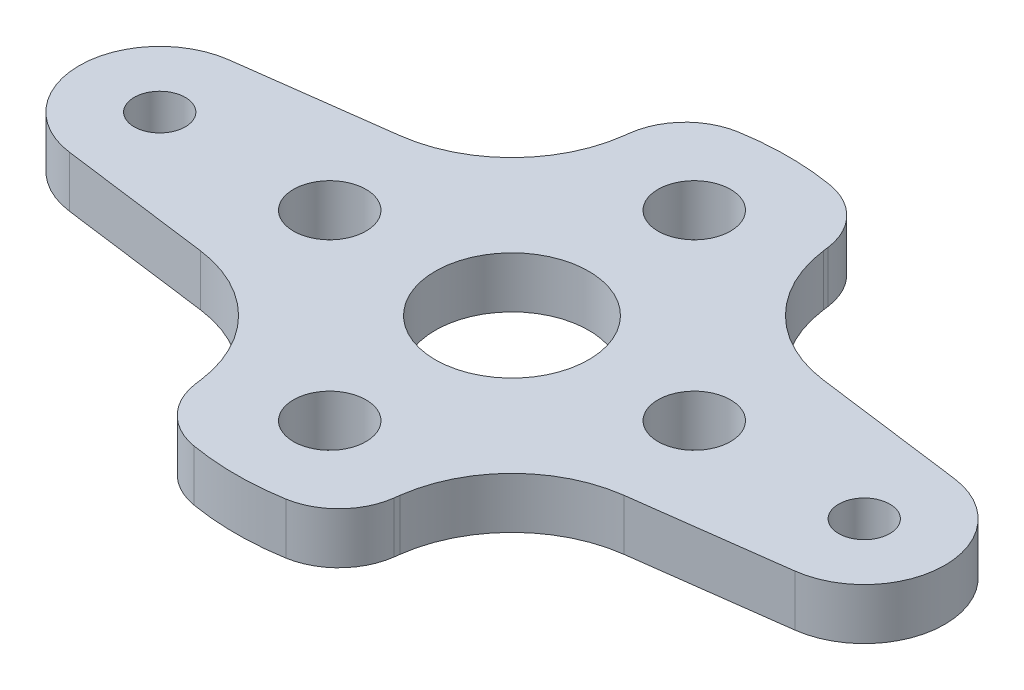
from build123d import *

# Parameters (mm, degrees)
BOSS_EXTRUDE1_DEPTH        = 3.175
F_1_8_0_1250_DOWEL_HOLE1_D = 3.175
SKETCH4_R                  = 4.7625
CUT_EXTRUDE1_DEPTH         = 39.125563171
M4_CLEARANCE_HOLE1_D       = 4.5
SKETCH7_R                  = 1.5875
CUT_EXTRUDE2_DEPTH         = 39.125563171
FILLET1_R                  = 4


with BuildPart() as part:
    # Sketch1 → Boss-Extrude1 (new body)
    with BuildSketch(Plane(origin=(0, 0, 0), x_dir=(1, 0, 0), z_dir=(0, 1, 0))):
        with BuildLine():
            Line((4.957224307, 22.517830961), (6.192571563, 13.134436958))
            ThreePointArc((6.192571563, 13.134436958), (8.485281374, 8.485281374), (13.134436958, 6.192571563))
            Line((13.134436958, 6.192571563), (22.517830961, 4.957224307))
            ThreePointArc((22.517830961, 4.957224307), (26.8652, 0), (22.517830961, -4.957224307))
            Line((22.517830961, -4.957224307), (13.134436958, -6.192571563))
            ThreePointArc((13.134436958, -6.192571563), (10.620595205, -6.955137122), (8.485281374, -8.485281374))
            Line((8.485281374, -8.485281374), (-8.485281374, 8.485281374))
            ThreePointArc((-8.485281374, 8.485281374), (-6.955137122, 10.620595205), (-6.192571563, 13.134436958))
            Line((-6.192571563, 13.134436958), (-4.957224307, 22.517830961))
            ThreePointArc((-4.957224307, 22.517830961), (0, 26.8652), (4.957224307, 22.517830961))
        make_face()
    boss_extrude1 = extrude(amount=BOSS_EXTRUDE1_DEPTH)

    # Mirror7: Boss-Extrude1 across plane
    add(boss_extrude1.mirror(Plane(origin=(-8.485281374, 3.175, -8.485281374), x_dir=(0.7071067811865467, 0, 0.7071067811865483), z_dir=(0.7071067811865486, 0, -0.7071067811865466))))

    # 1/8 (0.1250) Dowel Hole1 (through all)
    with Locations(Plane(origin=(0, 3.175, 0), x_dir=(1, 0, 0), z_dir=(0, 1, 0))):
        with Locations((0, 21.8652), (0, -21.8652), (-21.8652, 0), (21.8652, 0)):
            Hole(F_1_8_0_1250_DOWEL_HOLE1_D / 2)

    # Sketch4 → Cut-Extrude1 (cut, through all)
    with BuildSketch(Plane(origin=(0, 3.175, 0), x_dir=(1, 0, 0), z_dir=(0, 1, 0))):
        Circle(SKETCH4_R)
    extrude(amount=-CUT_EXTRUDE1_DEPTH, mode=Mode.SUBTRACT)

    # M4 Clearance Hole1 (through all)
    with Locations(Plane(origin=(0, 3.175, 0), x_dir=(1, 0, 0), z_dir=(0, 1, 0))):
        with Locations((-11.313708499, 0), (0, 11.313708499), (11.313708499, 0), (0, -11.313708499)):
            Hole(M4_CLEARANCE_HOLE1_D / 2)

    # Sketch7 → Cut-Extrude2 (cut, through all)
    # profile 1 of 2: a face of its own
    with BuildSketch(Plane(origin=(0, 3.175, 0), x_dir=(1, 0, 0), z_dir=(0, 1, 0))):
        with BuildLine():
            ThreePointArc((4.957224307, 22.517830961), (0, 26.8652), (-4.957224307, 22.517830961))
            Line((-4.957224307, 22.517830961), (-5.800499067, 16.112523234))
            ThreePointArc((-5.800499067, 16.112523234), (0, 17.124812244), (5.800499067, 16.112523234))
            Line((5.800499067, 16.112523234), (4.957224307, 22.517830961))
        make_face()
        with Locations((0, 21.8652)):
            Circle(SKETCH7_R, mode=Mode.SUBTRACT)
    # profile 2 of 2: a face of its own
    with BuildSketch(Plane(origin=(0, 3.175, 0), x_dir=(1, 0, 0), z_dir=(0, 1, 0))):
        with BuildLine():
            ThreePointArc((5.800499067, -16.112523234), (0, -17.124812244), (-5.800499067, -16.112523234))
            Line((-5.800499067, -16.112523234), (-4.957224307, -22.517830961))
            ThreePointArc((-4.957224307, -22.517830961), (0, -26.8652), (4.957224307, -22.517830961))
            Line((4.957224307, -22.517830961), (5.800499067, -16.112523234))
        make_face()
        with Locations((0, -21.8652)):
            Circle(SKETCH7_R, mode=Mode.SUBTRACT)
    extrude(amount=-CUT_EXTRUDE2_DEPTH, mode=Mode.SUBTRACT)

    # Fillet1
    fillet1_edges = [part.edges().sort_by_distance(p)[0] for p in [
        (5.800499067, 1.5875, -16.112523234),
        (-5.800499067, 1.5875, -16.112523234),
        (-5.800499067, 1.5875, 16.112523234),
        (5.800499067, 1.5875, 16.112523234),
    ]]
    fillet(fillet1_edges, radius=FILLET1_R)


solid = part.part
